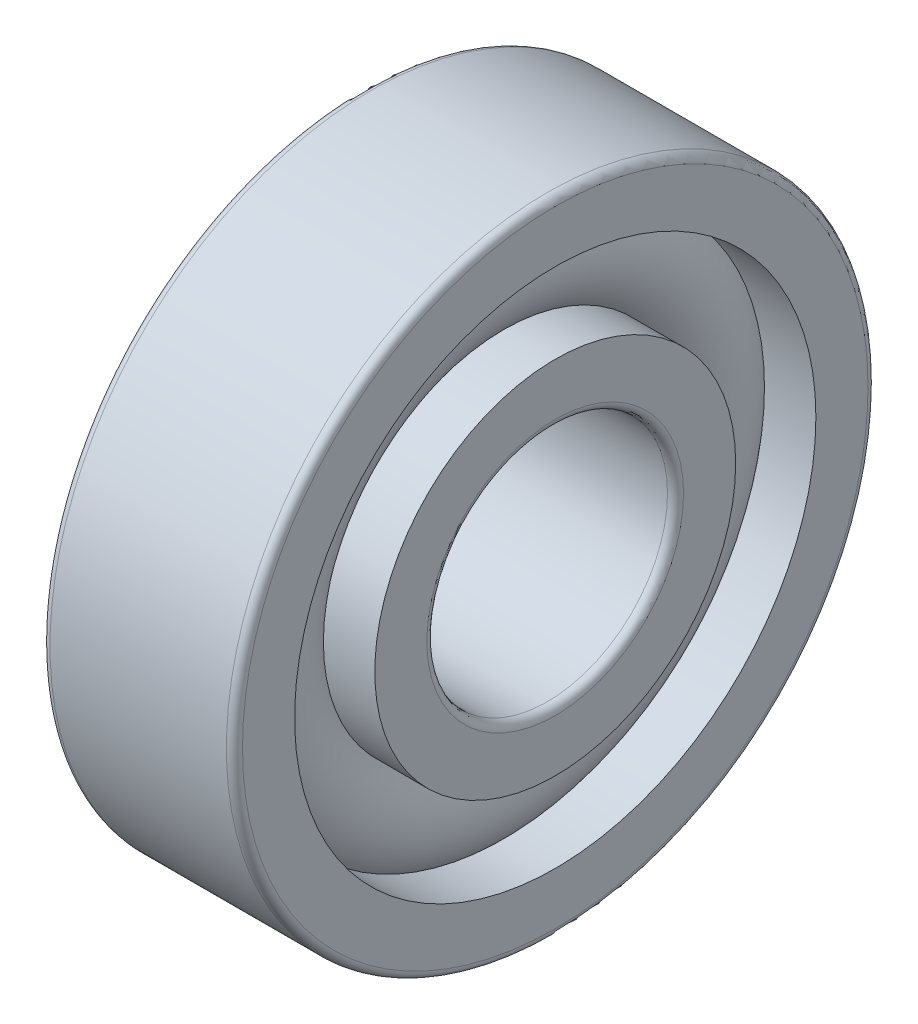
from build123d import *

# Parameters (mm, degrees)
CAGSPISKE_W     = 0.075
CAGSPISKE_H     = 0.125
CAGESPINE_ANGLE = 0.001
BALSIMSKE_R     = 0.375


with BuildPart() as part:
    # CagSpiSke → CageSpine (revolve)
    with BuildSketch(Plane.XY):
        with Locations((0, 1.375)):
            Rectangle(CAGSPISKE_W, CAGSPISKE_H)
    revolve(axis=Axis((-20.6375, 0, 0), (-1, 0, 0)), revolution_arc=CAGESPINE_ANGLE)

    # BalSimSke → BallsSimplified (revolve)
    with BuildSketch(Plane.XY):
        with Locations((0, 1.375)):
            Circle(BALSIMSKE_R)
    revolve(axis=Axis((-10, 0, 0), (1, 0, 0)))

    # InnRacSke → InnerRace (revolve)
    with BuildSketch(Plane.XY):
        with BuildLine():
            Line((-0.244948974, 1.125), (-0.6, 1.125))
            Line((-0.6, 1.125), (-0.6, 0.8))
            ThreePointArc((-0.6, 0.8), (-0.585355339, 0.764644661), (-0.55, 0.75))
            Line((-0.55, 0.75), (0.55, 0.75))
            ThreePointArc((0.55, 0.75), (0.585355339, 0.764644661), (0.6, 0.8))
            Line((0.6, 0.8), (0.6, 1.125))
            Line((0.6, 1.125), (0.244948974, 1.125))
            ThreePointArc((0.244948974, 1.125), (0, 1.025), (-0.244948974, 1.125))
        make_face()
    revolve(axis=Axis((-20.6375, 0, 0), (1, 0, 0)))

    # OutRacSke → OuterRace (revolve)
    with BuildSketch(Plane.XY):
        with BuildLine():
            Line((-0.244948974, 1.625), (-0.6, 1.625))
            Line((-0.6, 1.625), (-0.6, 1.95))
            ThreePointArc((-0.6, 1.95), (-0.585355339, 1.985355339), (-0.55, 2))
            Line((-0.55, 2), (0.55, 2))
            ThreePointArc((0.55, 2), (0.585355339, 1.985355339), (0.6, 1.95))
            Line((0.6, 1.95), (0.6, 1.625))
            Line((0.6, 1.625), (0.244948974, 1.625))
            ThreePointArc((0.244948974, 1.625), (0, 1.725), (-0.244948974, 1.625))
        make_face()
    revolve(axis=Axis((-20.6375, 0, 0), (1, 0, 0)))


solid = part.part
